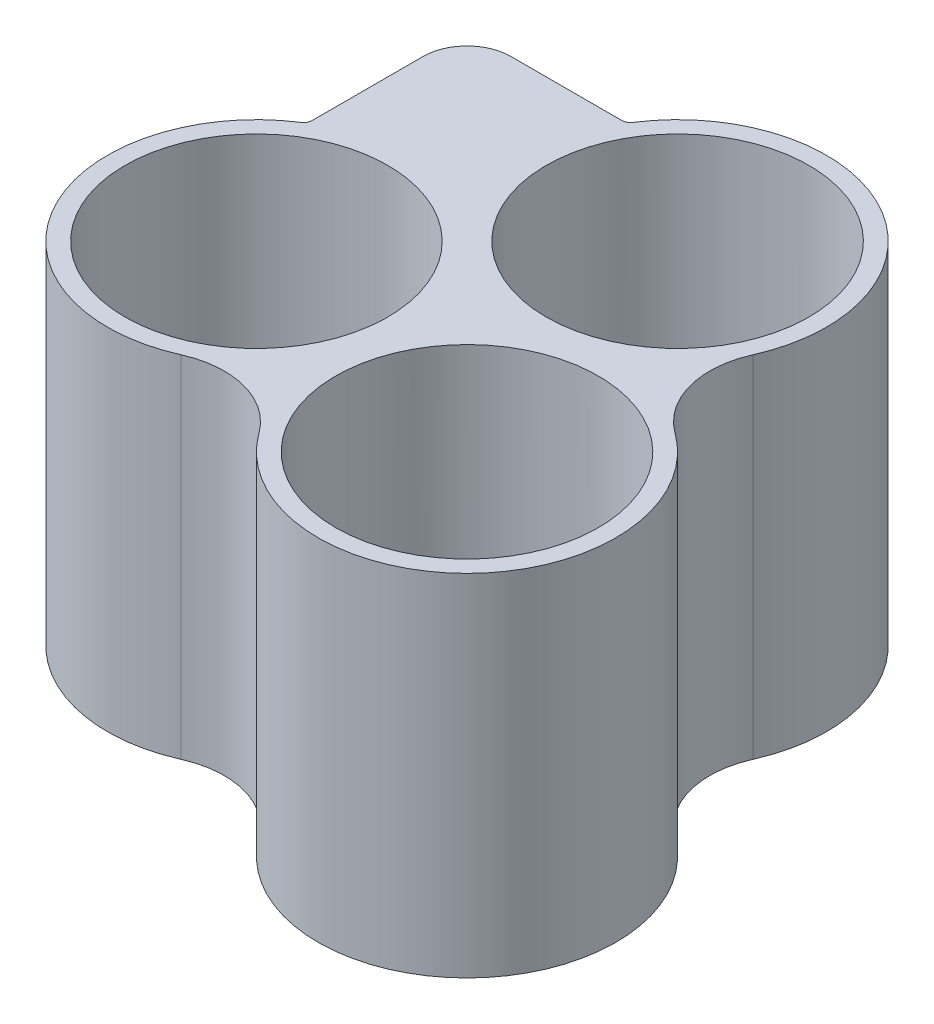
from build123d import *
from build123d.topology import SkipClean

# Parameters (mm, degrees)
SKETCH1_W                = 30
SKETCH1_H                = 30
BOSS_EXTRUDE1_DEPTH      = 80
SKETCH2_R                = 6
BOSS_EXTRUDE2_DEPTH      = 22
CUT_EXTRUDE1_DEPTH       = 83.764726786
BOSS_EXTRUDE3_DEPTH      = 100
BOSS_EXTRUDE5_DEPTH      = 2
BOSS_EXTRUDE6_DEPTH      = 23
BOSS_EXTRUDE7_DEPTH      = 25
FILLET1_R                = 2
SKETCH11_R               = 6.055782361
CUT_EXTRUDE2_DEPTH       = 2.125
SKETCH12_W               = 13.25
SKETCH12_H               = 8.5
CUT_EXTRUDE4_DEPTH       = 13.25
CUT_EXTRUDE5_REACH       = 204.341
SKETCH15_W               = 3.75
SKETCH15_H               = 3.75
FILLET2_R                = 1
CUT_EXTRUDE7_START       = 22
SKETCH16_R               = 6
CUT_EXTRUDE7_DEPTH       = 22
SKETCH17_R               = 15
BOSS_EXTRUDE8_DEPTH      = 40
FILLET3_R                = 1
SKETCH18_R               = 15
SKETCH18_R_2             = 7.5
BOSS_EXTRUDE9_DEPTH      = 2
SKETCH22_R               = 209.016423622
CUT_EXTRUDE8_DEPTH       = 225.815151847
SKETCH23_W               = 22.070362909
SKETCH23_H               = 16.212180161
CUT_EXTRUDE9_DEPTH       = 65.514197169
SKETCH24_R               = 15
BOSS_EXTRUDE10_DEPTH     = 40
SKETCH25_R               = 15
SKETCH25_R_2             = 7.5
BOSS_EXTRUDE11_DEPTH     = 2
BOSS_EXTRUDE12_DEPTH     = 40
SKETCH29_R               = 2
CUT_EXTRUDE10_DEPTH      = 209.128716183
SKETCH30_R               = 3.025
CUT_EXTRUDE11_DEPTH      = 2.1
CUT_EXTRUDE12_DEPTH      = 111.386253673
CUT_EXTRUDE12_DEPTH_BACK = 111.386253673
SKETCH31_W               = 80
SKETCH31_H               = 80
BOSS_EXTRUDE13_DEPTH     = 190
CUT_EXTRUDE13_DEPTH      = 191.213565988
CUT_EXTRUDE13_DEPTH_BACK = 191.213565988
SKETCH33_W               = 75.892651359
SKETCH33_H               = 150.831877449
SKETCH36_R               = 5
CUT_EXTRUDE14_DEPTH      = 15


with BuildPart() as part:
    # Sketch1 → Boss-Extrude1 (new body)
    with BuildSketch(Plane(origin=(0, 0, 0), x_dir=(1, 0, 0), z_dir=(0, 1, 0))):
        Rectangle(SKETCH1_W, SKETCH1_H)
    extrude(amount=BOSS_EXTRUDE1_DEPTH)

    # Sketch2 → Boss-Extrude2 (add)
    with BuildSketch(Plane(origin=(0, 80, 0), x_dir=(1, 0, 0), z_dir=(0, 1, 0))):
        with Locations(Location((9, -9, 0), (0, 0, 270))):
            Circle(SKETCH2_R)
    extrude(amount=BOSS_EXTRUDE2_DEPTH)

    # Sketch3 → Cut-Extrude1 (cut, through all)
    with BuildSketch(Plane(origin=(0, 80, 0), x_dir=(1, 0, 0), z_dir=(0, 1, 0))):
        with BuildLine():
            Line((9, -15), (15, -15))
            Line((15, -15), (15, -9))
            ThreePointArc((15, -9), (13.242640687, -13.242640687), (9, -15))
        make_face()
    extrude(amount=-CUT_EXTRUDE1_DEPTH, mode=Mode.SUBTRACT)

    # Sketch4 → Boss-Extrude3 (add)
    with BuildSketch(Plane(origin=(0, 80, 0), x_dir=(1, 0, 0), z_dir=(0, 1, 0))):
        Polygon((-8.25, 11.25), (-8.25, 8.25), (-11.25, 8.25), (-15, 8.25), (-15, 11.25), (-11.25, 11.25), (-11.25, 15), (-8.25, 15), align=None)
        Polygon((-1.75, 1.75), (-11.25, 1.75), (-15, 1.75), (-15, -1.25), (-11.25, -1.25), (1.25, -1.25), (1.25, 11.25), (1.25, 15), (-1.75, 15), (-1.75, 11.25), align=None)
    extrude(amount=BOSS_EXTRUDE3_DEPTH)

    # Sketch6 → Boss-Extrude5 (add)
    with BuildSketch(Plane.XZ):
        with BuildLine():
            Line((15, -15), (7, -15))
            Line((7, -15), (7, -99.5))
            ThreePointArc((7, -99.5), (2.757359313, -109.742640687), (13, -105.5))
            Line((13, -105.5), (15, -105.5))
            Line((15, -105.5), (15, -15))
        make_face()
    extrude(amount=-BOSS_EXTRUDE5_DEPTH)

    # Sketch7 → Boss-Extrude6 (add)
    with SkipClean():  # the faces are left unmerged after this step: merging them gives an invalid solid
        with BuildSketch(Plane(origin=(0, 2, 0), x_dir=(1, 0, 0), z_dir=(0, 1, 0))):
            with BuildLine():
                Line((9, 111.156854249), (9, 108.964101615))
                ThreePointArc((9, 108.964101615), (7, 101.5), (5, 108.964101615))
                Line((5, 108.964101615), (5, 111.156854249))
                ThreePointArc((5, 111.156854249), (1.086408642, 104.485388128), (7, 99.5))
                Line((7, 99.5), (7, 15))
                Line((7, 15), (15, 15))
                Line((15, 15), (15, 105.5))
                Line((15, 105.5), (13, 105.5))
                ThreePointArc((13, 105.5), (11.898979486, 108.964101615), (9, 111.156854249))
            make_face()
        extrude(amount=BOSS_EXTRUDE6_DEPTH)

    # Sketch9 → Boss-Extrude7 (add)
    with SkipClean():  # the faces are left unmerged after this step: merging them gives an invalid solid
        with BuildSketch(Plane.XZ):
            with BuildLine():
                Line((-15, 15), (-15, 7))
                Line((-15, 7), (-126.175, 7))
                ThreePointArc((-126.175, 7), (-126.252697751, 6.037536458), (-126.48377869, 5.1))
                Line((-126.48377869, 5.1), (-128.797778509, 5.1))
                ThreePointArc((-128.797778509, 5.1), (-136.05, 7), (-128.797778509, 8.9))
                Line((-128.797778509, 8.9), (-126.3, 8.9))
                ThreePointArc((-126.3, 8.9), (-128.491885554, 11.955834237), (-132.050001601, 13.173329766))
                Line((-132.050001601, 13.173329766), (-132.050001601, 15))
                Line((-132.050001601, 15), (-15, 15))
            make_face()
        extrude(amount=-BOSS_EXTRUDE7_DEPTH)

    # Fillet1
    fillet1_edges = [part.edges().sort_by_distance(p)[0] for p in [
        (-126.175, 12.5, 7),
    ]]
    fillet(fillet1_edges, radius=FILLET1_R)

    # Sketch11 → Cut-Extrude2 (cut)
    with SkipClean():  # the faces are left unmerged after this step: merging them gives an invalid solid
        with BuildSketch(Plane.XZ):
            with Locations((-132.175, 7)):
                Circle(SKETCH11_R)
        extrude(amount=-CUT_EXTRUDE2_DEPTH, mode=Mode.SUBTRACT)

    # Sketch12 → Cut-Extrude4 (cut)
    with SkipClean():  # the faces are left unmerged after this step: merging them gives an invalid solid
        with BuildSketch(Plane.ZY.offset(15)):
            with Locations((-8.375, 72.75)):
                Rectangle(SKETCH12_W, SKETCH12_H)
        extrude(amount=-CUT_EXTRUDE4_DEPTH, mode=Mode.SUBTRACT)

    # Sketch15 → Cut-Extrude5 (cut, up to next)
    with BuildSketch(Plane(origin=(0, 80, 0), x_dir=(1, 0, 0), z_dir=(0, 1, 0)), mode=Mode.PRIVATE) as cut_extrude5_sk1:
        with Locations((-13.125, 13.125)):
            Rectangle(SKETCH15_W, SKETCH15_H)
    cut_extrude5_tool1 = extrude(cut_extrude5_sk1.sketch, amount=-CUT_EXTRUDE5_REACH, mode=Mode.PRIVATE) & part.part
    add(cut_extrude5_tool1.solids().sort_by_distance((-13.125, 80, -13.125))[0], mode=Mode.SUBTRACT)

    # Fillet2
    fillet2_edges = [part.edges().sort_by_distance(p)[0] for p in [
        (-11.25, 130, -15),
        (-11.25, 130, -11.25),
        (-15, 130, -11.25),
        (-15, 130, 1.25),
        (1.25, 130, -15),
    ]]
    fillet(fillet2_edges, radius=FILLET2_R)

    # Sketch16 → Cut-Extrude7 (cut)
    with SkipClean():  # the faces are left unmerged after this step: merging them gives an invalid solid
        with BuildSketch(Plane(origin=(0, 80, 0), x_dir=(1, 0, 0), z_dir=(0, 1, 0)).offset(CUT_EXTRUDE7_START)):
            with Locations((9, -9)):
                Circle(SKETCH16_R)
        extrude(amount=-CUT_EXTRUDE7_DEPTH, mode=Mode.SUBTRACT)


with BuildPart() as cut_extrude7_kept_piece:
    # of the separate pieces the step leaves, the one the design keeps (cut_extrude7_pieces_kept)
    add(part.part.solids().sort_by_distance((-15, 80, 0.25))[0])

    # Sketch17 → Boss-Extrude8 (add)
    with SkipClean():  # the faces are left unmerged after this step: merging them gives an invalid solid
        with BuildSketch(Plane(origin=(0, 180, 0), x_dir=(1, 0, 0), z_dir=(0, 1, 0))):
            with BuildLine():
                Line((-14, -1.25), (-14, -4.216394713))
                ThreePointArc((-14, -4.216394713), (-14.384018227, -33.129332993), (11.657578086, -20.561885701))
                ThreePointArc((11.657578086, -20.561885701), (14.532144442, -14.532144442), (20.561885701, -11.657578086))
                ThreePointArc((20.561885701, -11.657578086), (33.129332993, 14.384018227), (4.216394713, 14))
                Line((4.216394713, 14), (1.25, 14))
                Line((1.25, 14), (1.25, -1.25))
                Line((1.25, -1.25), (-14, -1.25))
            make_face()
            with Locations(Location((18.79163056, 5.25, 0), (0, 0, 270))):
                Circle(SKETCH17_R, mode=Mode.SUBTRACT)
            with Locations(Location((-5.25, -18.79163056, 0), (0, 0, 270))):
                Circle(SKETCH17_R, mode=Mode.SUBTRACT)
        extrude(amount=-BOSS_EXTRUDE8_DEPTH)

    # Fillet3
    # the kernel refuses this fillet: 1 mm, written as the material it adds along each edge
    with BuildSketch(Plane(origin=(-14, 140, 1.25), x_dir=(-0.9659258262890684, 0, -0.25881904510252046), z_dir=(0, 1, 0))) as fillet3_piece_1:
        with BuildLine():
            CenterArc((0.776457135, 0.965925826), FILLET3_R, 195, 60)
            Line((-0.189468691, 0.707106781), (0, 0))
            ThreePointArc((0, 0), (0.258819045, 0.034074174), (0.51763809, 0))
        make_face()
    extrude(amount=40)
    with BuildSketch(Plane(origin=(-14, 180, 4.216394713), x_dir=(0, 0, -1), z_dir=(0, -1, 0))) as fillet3_piece_2:
        with BuildLine():
            CenterArc((0.555444904, -1), FILLET3_R, 90, 57.202831704)
            ThreePointArc((-0.285148471, -0.458333333), (-0.140754957, -0.230298516), (0, 0))
            Line((0, 0), (0.555444904, 0))
        make_face()
    extrude(amount=40)
    with BuildSketch(Plane(origin=(1.25, 140, -14), x_dir=(-0.2588190451025201, 0, -0.9659258262890685), z_dir=(0, 1, 0))) as fillet3_piece_3:
        with BuildLine():
            CenterArc((0.776457135, -0.965925826), FILLET3_R, 105, 60)
            Line((-0.189468691, -0.707106781), (0, 0))
            ThreePointArc((0, 0), (0.258819045, -0.034074174), (0.51763809, 0))
        make_face()
    extrude(amount=40)
    with BuildSketch(Plane(origin=(4.216394713, 180, -14), x_dir=(-1, 0, 0), z_dir=(0, -1, 0))) as fillet3_piece_4:
        with BuildLine():
            CenterArc((0.555444904, 1), FILLET3_R, 212.797168296, 57.202831704)
            ThreePointArc((-0.285148471, 0.458333333), (-0.140754957, 0.230298516), (0, 0))
            Line((0, 0), (0.555444904, 0))
        make_face()
    extrude(amount=40)

    # Sketch18 → Boss-Extrude9 (add)
    with SkipClean():  # the faces are left unmerged after this step: merging them gives an invalid solid
        with BuildSketch(Plane.XZ.offset(-140)):
            with Locations(Location((-5.25, 18.79163056, 0), (0, 0, 90))):
                Circle(SKETCH18_R)
            with Locations(Location((-5.25, 18.79163056, 0), (0, 0, 270))):
                Circle(SKETCH18_R_2, mode=Mode.SUBTRACT)
        boss_extrude9 = extrude(amount=-BOSS_EXTRUDE9_DEPTH)

    # Sketch21 → Revolve1 (revolve)
    with SkipClean():  # the faces are left unmerged after this step: merging them gives an invalid solid
        with BuildSketch(Plane(origin=(-5.25, 0, 0), x_dir=(0, 0, -1), z_dir=(-1, 0, 0)), mode=Mode.PRIVATE) as revolve1_sk:
            Polygon((-11.29163056, -142), (-3.79163056, -154.5), (-3.79163056, -142), align=None)
        revolve1 = revolve(revolve1_sk.sketch.rotate(Axis((-5.25, 1065, 18.79163056), (0, -1, 0)), 180), axis=Axis((-5.25, 1065, 18.79163056), (0, -1, 0)))

    # Mirror1: Boss-Extrude9, Revolve1 across plane
    with SkipClean():  # the faces are left unmerged after this step: merging them gives an invalid solid
        add(boss_extrude9.mirror(Plane(origin=(0, 0, 0), x_dir=(0.7071067811865478, 0, 0.7071067811865472), z_dir=(0.7071067811865475, 0, -0.7071067811865477))))
        add(revolve1.mirror(Plane(origin=(0, 0, 0), x_dir=(0.7071067811865478, 0, 0.7071067811865472), z_dir=(0.7071067811865475, 0, -0.7071067811865477))))

    # Sketch22 → Cut-Extrude8 (cut, through all)
    with BuildSketch(Plane.XZ.offset(-140)):
        Circle(SKETCH22_R)
    extrude(amount=CUT_EXTRUDE8_DEPTH, mode=Mode.SUBTRACT)


with BuildPart() as cut_extrude8_piece_1:
    # of the separate pieces the step leaves, piece 1, a body of its own (cut_extrude8_pieces)
    add(cut_extrude7_kept_piece.part.solids().sort_by_distance((4.501543184, 180, -14.458333333))[0])

    # Sketch24 → Boss-Extrude10 (add)
    with BuildSketch(Plane(origin=(0, 180, 0), x_dir=(1, 0, 0), z_dir=(0, 1, 0))):
        with BuildLine():
            ThreePointArc((13.834213525, -37.57835306), (39.612293374, -39.612293374), (37.57835306, -13.834213525))
            ThreePointArc((37.57835306, -13.834213525), (33.79372713, -8.329895406), (34.31915027, -1.67070312))
            ThreePointArc((34.31915027, -1.67070312), (28.778505526, -8.507264569), (20.561885701, -11.657578086))
            ThreePointArc((20.561885701, -11.657578086), (14.532144442, -14.532144442), (11.657578086, -20.561885701))
            ThreePointArc((11.657578086, -20.561885701), (8.507264569, -28.778505526), (1.67070312, -34.31915027))
            ThreePointArc((1.67070312, -34.31915027), (8.329895406, -33.79372713), (13.834213525, -37.57835306))
        make_face()
        with Locations(Location((27.591478094, -27.591478094, 0), (0, 0, 270))):
            Circle(SKETCH24_R, mode=Mode.SUBTRACT)
    extrude(amount=-BOSS_EXTRUDE10_DEPTH)

    # Sketch25 → Boss-Extrude11 (add)
    with BuildSketch(Plane.XZ.offset(-140)):
        with Locations(Location((27.591478094, 27.591478094, 0), (0, 0, 90))):
            Circle(SKETCH25_R)
        with Locations(Location((27.591478094, 27.591478094, 0), (0, 0, 270))):
            Circle(SKETCH25_R_2, mode=Mode.SUBTRACT)
    extrude(amount=-BOSS_EXTRUDE11_DEPTH)

    # Sketch26 → Revolve2 (revolve)
    with BuildSketch(Plane(origin=(0, 0, 0), x_dir=(-0.7071067811865476, 0, -0.7071067811865475), z_dir=(0.7071067811865475, 0, -0.7071067811865476)), mode=Mode.PRIVATE) as revolve2_sk:
        Polygon((-24.020242526, 142), (-24.020242526, 154.5), (-31.520242526, 142), align=None)
    revolve(revolve2_sk.sketch.rotate(Axis((27.591478094, 126.995387654, 27.591478094), (0, 1, 0)), 135), axis=Axis((27.591478094, 126.995387654, 27.591478094), (0, 1, 0)))

    # Sketch27 → Boss-Extrude12 (add)
    with BuildSketch(Plane(origin=(0, 180, 0), x_dir=(1, 0, 0), z_dir=(0, 1, 0))):
        Polygon((2.25, -2.25), (2.25, 72.75), (-1.75, 72.75), (-1.75, 1.75), (-72.75, 1.75), (-72.75, -2.25), align=None)
    extrude(amount=-BOSS_EXTRUDE12_DEPTH)

    # Sketch29 → Cut-Extrude10 (cut, through all)
    with BuildSketch(Plane.XY.offset(2.25)):
        with Locations((-24, 144)):
            Circle(SKETCH29_R)
        with Locations((-24, 176)):
            Circle(SKETCH29_R)
        with Locations((-68.75, 144)):
            Circle(SKETCH29_R)
        with Locations((-68.75, 176)):
            Circle(SKETCH29_R)
    cut_extrude10 = extrude(amount=-CUT_EXTRUDE10_DEPTH, mode=Mode.SUBTRACT)

    # Sketch30 → Cut-Extrude11 (cut)
    with BuildSketch(Plane(origin=(0, 0, -1.75), x_dir=(-1, 0, 0), z_dir=(0, 0, -1))):
        with Locations((14.135, 148)):
            Circle(SKETCH30_R)
        with Locations((29.545, 148)):
            Circle(SKETCH30_R)
        with Locations((44.955, 148)):
            Circle(SKETCH30_R)
        with Locations((60.365, 148)):
            Circle(SKETCH30_R)
        with Locations(Location((60.365, 172, 0), (0, 0, 180))):
            Circle(SKETCH30_R)
        with Locations(Location((44.955, 172, 0), (0, 0, 180))):
            Circle(SKETCH30_R)
        with Locations(Location((29.545, 172, 0), (0, 0, 180))):
            Circle(SKETCH30_R)
        with Locations(Location((14.135, 172, 0), (0, 0, 180))):
            Circle(SKETCH30_R)
    cut_extrude11 = extrude(amount=-CUT_EXTRUDE11_DEPTH, mode=Mode.SUBTRACT)

    # Mirror2: Cut-Extrude10, Cut-Extrude11 across plane
    add(cut_extrude10.mirror(Plane(origin=(0, 0, 0), x_dir=(0.7071067811865476, 0, 0.7071067811865475), z_dir=(0.7071067811865475, 0, -0.7071067811865476))), mode=Mode.SUBTRACT)
    add(cut_extrude11.mirror(Plane(origin=(0, 0, 0), x_dir=(0.7071067811865476, 0, 0.7071067811865475), z_dir=(0.7071067811865475, 0, -0.7071067811865476))), mode=Mode.SUBTRACT)

    # Sketch31 → Cut-Extrude12 (cut, two sides: drawn at the far end of the back side and taken through both)
    with BuildSketch(Plane(origin=(0, 180, 0), x_dir=(1, 0, 0), z_dir=(0, 1, 0)).offset(-CUT_EXTRUDE12_DEPTH_BACK)):
        with Locations((-37.75, 37.75)):
            Rectangle(SKETCH31_W, SKETCH31_H)
    extrude(amount=CUT_EXTRUDE12_DEPTH + CUT_EXTRUDE12_DEPTH_BACK, mode=Mode.SUBTRACT)

    # Sketch32 → Boss-Extrude13 (add)
    with BuildSketch(Plane(origin=(0, 180, 0), x_dir=(1, 0, 0), z_dir=(0, 1, 0))):
        with BuildLine():
            Line((-14, -2.25), (2.25, -2.25))
            Line((2.25, -2.25), (2.25, 14))
            Line((2.25, 14), (-9, 14))
            ThreePointArc((-9, 14), (-12.535533906, 12.535533906), (-14, 9))
            Line((-14, 9), (-14, -2.25))
        make_face()
    extrude(amount=-BOSS_EXTRUDE13_DEPTH)

    # Sketch33 → Cut-Extrude13 (cut, two sides: drawn at the far end of the back side and taken through both)
    with BuildSketch(Plane.XY.offset(2.25).offset(-CUT_EXTRUDE13_DEPTH_BACK)):
        with Locations((-20.864349969, 64.584061276)):
            Rectangle(SKETCH33_W, SKETCH33_H)
    extrude(amount=CUT_EXTRUDE13_DEPTH + CUT_EXTRUDE13_DEPTH_BACK, mode=Mode.SUBTRACT)

    # Sketch36 → Cut-Extrude14 (cut)
    with BuildSketch(Plane.XZ.offset(-140)):
        with Locations(Location((-5.875, -5.875, 0), (0, 0, 270))):
            Circle(SKETCH36_R)
    extrude(amount=-CUT_EXTRUDE14_DEPTH, mode=Mode.SUBTRACT)


with BuildPart() as cut_extrude8_piece_2:
    # of the separate pieces the step leaves, piece 2, a body of its own (cut_extrude8_pieces)
    add(cut_extrude7_kept_piece.part.solids().sort_by_distance((-10.25, 140, -15))[0])

    # Sketch23 → Cut-Extrude9 (cut, through all)
    with BuildSketch(Plane(origin=(0, 180, 0), x_dir=(1, 0, 0), z_dir=(0, 1, 0))):
        with Locations((-15.719387653, 13.178118111)):
            Rectangle(SKETCH23_W, SKETCH23_H)
    extrude(amount=-CUT_EXTRUDE9_DEPTH, mode=Mode.SUBTRACT)


solid = cut_extrude8_piece_1.part
